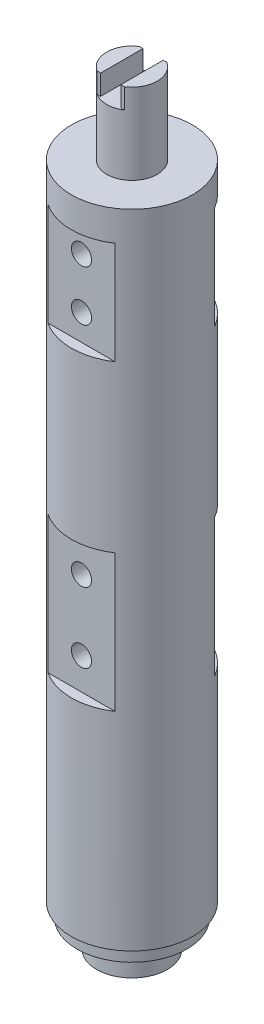
from build123d import *

# Parameters (mm, degrees)
SKETCH1_R                      = 19.05
BOSS_EXTRUDE1_DEPTH            = 254
SKETCH2_W                      = 11.1125
SKETCH2_H                      = 38.989
CUT_EXTRUDE1_DEPTH             = 256.424754086
CUT_EXTRUDE1_DEPTH_BACK        = 256.424754086
SKETCH3_W                      = 9.525
SKETCH3_H                      = 32.258
SKETCH3_H_2                    = 43.18
SKETCH3_W_2                    = 3.175
F_1_1_DIAMETER_HOLE1_D         = 6.35
CUT_EXTRUDE2_REACH             = 257.425
SKETCH7_W                      = 15.875
SKETCH7_H                      = 13.589
CUT_EXTRUDE2_DIRECTION_2_REACH = 257.425
CUT_EXTRUDE3_REACH             = 243.916
SKETCH8_W                      = 1.27
SKETCH8_H                      = 6.35
CUT_EXTRUDE3_DIRECTION_2_REACH = 243.916
SKETCH9_W                      = 6.35
SKETCH9_H                      = 13.335
CUT_EXTRUDE4_DEPTH             = 6.35


with BuildPart() as part:
    # Sketch1 → Boss-Extrude1 (new body)
    with BuildSketch(Plane(origin=(0, 0, 0), x_dir=(1, 0, 0), z_dir=(0, 1, 0))):
        Circle(SKETCH1_R)
    extrude(amount=BOSS_EXTRUDE1_DEPTH)

    # Sketch2 → Cut-Revolve1 (revolve, cut)
    with BuildSketch(Plane.XY):
        Polygon((19.05, 0), (11.1125, 0), (11.1125, 8.636), (17.272, 8.636), (17.272, 12.954), (19.05, 12.954), align=None)
        with Locations((13.49375, 234.5055)):
            Rectangle(SKETCH2_W, SKETCH2_H)
    revolve(axis=Axis((0, 348.337253792, 0), (0, -1, 0)), mode=Mode.SUBTRACT)

    # Sketch3 → Cut-Extrude1 (cut, two sides: drawn at the far end of the back side and taken through both)
    with BuildSketch(Plane(origin=(0, 0, 0), x_dir=(0, 0, -1), z_dir=(1, 0, 0)).offset(-CUT_EXTRUDE1_DEPTH_BACK)):
        with Locations((14.2875, 189.357)):
            Rectangle(SKETCH3_W, SKETCH3_H)
        with Locations((14.2875, 99.568)):
            Rectangle(SKETCH3_W, SKETCH3_H_2)
        with Locations((-17.4625, 189.357)):
            Rectangle(SKETCH3_W_2, SKETCH3_H)
        with Locations((-17.4625, 99.568)):
            Rectangle(SKETCH3_W_2, SKETCH3_H_2)
    extrude(amount=CUT_EXTRUDE1_DEPTH + CUT_EXTRUDE1_DEPTH_BACK, mode=Mode.SUBTRACT)

    # 1 (1) Diameter Hole1 (through all)
    with Locations(Plane(origin=(0, 0, -9.525), x_dir=(-1, 0, 0), z_dir=(0, 0, -1))):
        with Locations((0, 197.2945), (0, 181.4195), (0, 109.982), (0, 87.884)):
            Hole(F_1_1_DIAMETER_HOLE1_D / 2)

    # Sketch7 → Cut-Extrude2 (cut, up to next)
    with BuildSketch(Plane.XY, mode=Mode.PRIVATE) as cut_extrude2_sk1:
        with Locations((0, 247.2055)):
            Rectangle(SKETCH7_W, SKETCH7_H)
    cut_extrude2_tool1 = extrude(cut_extrude2_sk1.sketch, amount=-CUT_EXTRUDE2_REACH, mode=Mode.PRIVATE) & part.part
    add(cut_extrude2_tool1.solids().sort_by_distance((0, 247.2055, 0))[0], mode=Mode.SUBTRACT)

    # Sketch7 → Cut-Extrude2 direction 2 (cut, up to next)
    with BuildSketch(Plane.XY, mode=Mode.PRIVATE) as cut_extrude2_direction_2_sk1:
        with Locations((0, 247.2055)):
            Rectangle(SKETCH7_W, SKETCH7_H)
    cut_extrude2_direction_2_tool1 = extrude(cut_extrude2_direction_2_sk1.sketch, amount=CUT_EXTRUDE2_DIRECTION_2_REACH, mode=Mode.PRIVATE) & part.part
    add(cut_extrude2_direction_2_tool1.solids().sort_by_distance((0, 247.2055, 0))[0], mode=Mode.SUBTRACT)

    # Sketch8 → Cut-Extrude3 (cut, up to next)
    with BuildSketch(Plane(origin=(0, 0, 0), x_dir=(0, 0, -1), z_dir=(1, 0, 0)), mode=Mode.PRIVATE) as cut_extrude3_sk1:
        with Locations((7.3025, 237.236)):
            Rectangle(SKETCH8_W, SKETCH8_H)
    cut_extrude3_tool1 = extrude(cut_extrude3_sk1.sketch, amount=-CUT_EXTRUDE3_REACH, mode=Mode.PRIVATE) & part.part
    # Sketch8 → Cut-Extrude3 (cut, up to next)
    with BuildSketch(Plane(origin=(0, 0, 0), x_dir=(0, 0, -1), z_dir=(1, 0, 0)), mode=Mode.PRIVATE) as cut_extrude3_sk2:
        with Locations((-7.3025, 237.236)):
            Rectangle(SKETCH8_W, SKETCH8_H)
    cut_extrude3_tool2 = extrude(cut_extrude3_sk2.sketch, amount=-CUT_EXTRUDE3_REACH, mode=Mode.PRIVATE) & part.part
    add(cut_extrude3_tool1.solids().sort_by_distance((0, 237.236, -7.3025))[0], mode=Mode.SUBTRACT)
    add(cut_extrude3_tool2.solids().sort_by_distance((0, 237.236, 7.3025))[0], mode=Mode.SUBTRACT)

    # Sketch8 → Cut-Extrude3 direction 2 (cut, up to next)
    with BuildSketch(Plane(origin=(0, 0, 0), x_dir=(0, 0, -1), z_dir=(1, 0, 0)), mode=Mode.PRIVATE) as cut_extrude3_direction_2_sk1:
        with Locations((7.3025, 237.236)):
            Rectangle(SKETCH8_W, SKETCH8_H)
    cut_extrude3_direction_2_tool1 = extrude(cut_extrude3_direction_2_sk1.sketch, amount=CUT_EXTRUDE3_DIRECTION_2_REACH, mode=Mode.PRIVATE) & part.part
    # Sketch8 → Cut-Extrude3 direction 2 (cut, up to next)
    with BuildSketch(Plane(origin=(0, 0, 0), x_dir=(0, 0, -1), z_dir=(1, 0, 0)), mode=Mode.PRIVATE) as cut_extrude3_direction_2_sk2:
        with Locations((-7.3025, 237.236)):
            Rectangle(SKETCH8_W, SKETCH8_H)
    cut_extrude3_direction_2_tool2 = extrude(cut_extrude3_direction_2_sk2.sketch, amount=CUT_EXTRUDE3_DIRECTION_2_REACH, mode=Mode.PRIVATE) & part.part
    add(cut_extrude3_direction_2_tool1.solids().sort_by_distance((0, 237.236, -7.3025))[0], mode=Mode.SUBTRACT)
    add(cut_extrude3_direction_2_tool2.solids().sort_by_distance((0, 237.236, 7.3025))[0], mode=Mode.SUBTRACT)

    # Sketch9 → Cut-Extrude4 (cut)
    with BuildSketch(Plane(origin=(0, 240.411, 0), x_dir=(1, 0, 0), z_dir=(0, 1, 0))):
        Rectangle(SKETCH9_W, SKETCH9_H)
    extrude(amount=-CUT_EXTRUDE4_DEPTH, mode=Mode.SUBTRACT)


solid = part.part
